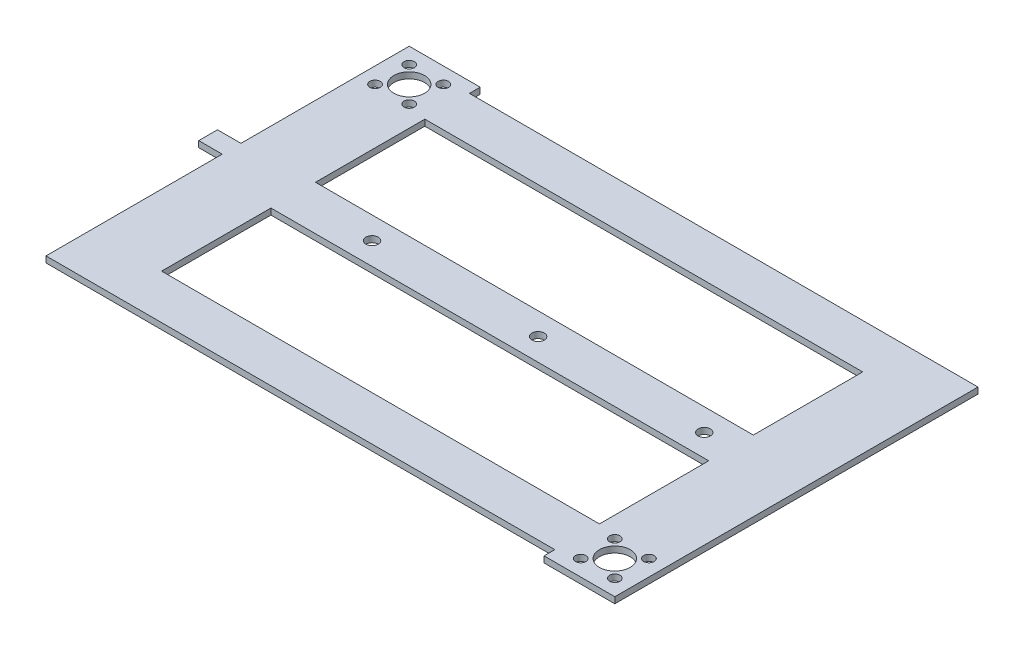
from build123d import *

# Parameters (mm, degrees)
SKETCH1_R           = 5
SKETCH1_R_2         = 1.7
SKETCH1_R_3         = 2
SKETCH1_W           = 142.3736446
SKETCH1_H           = 35.551129401
SKETCH1_H_2         = 35.551129402
BOSS_EXTRUDE1_DEPTH = 2


with BuildPart() as part:
    # Sketch1 → Boss-Extrude1 (new body)
    with BuildSketch(Plane(origin=(0, 0, 0), x_dir=(1, 0, 0), z_dir=(0, 1, 0))):
        Polygon((67.730491212, 150.133829438), (82.230491212, 150.133829438), (85.730491212, 150.133829438), (85.730491212, 100.082700036), (85.730491212, 85.582700036), (85.730491212, 50.031570635), (85.730491212, 32.031570635), (67.730491212, 32.031570635), (62.730491212, 32.031570635), (62.730491212, 35.531570635), (-84.727026002, 35.531570635), (-99.227026002, 35.531570635), (-102.727026002, 35.531570635), (-102.727026002, 85.582700036), (-102.727026002, 92.832700036), (-110.358379208, 92.832700036), (-110.358379208, 98.923608877), (-102.727026002, 98.923608877), (-102.727026002, 100.082700036), (-102.727026002, 153.633829438), (-84.643153388, 153.633829438), (-79.643153388, 153.633829438), (-79.643153388, 153.432122466), (-79.643153388, 150.133829438), align=None)
        with Locations((-91.977026002, 142.883829438)):
            Circle(SKETCH1_R, mode=Mode.SUBTRACT)
        with Locations((74.980491212, 42.781570635)):
            Circle(SKETCH1_R, mode=Mode.SUBTRACT)
        with Locations((-86.427026002, 148.433829438)):
            Circle(SKETCH1_R_2, mode=Mode.SUBTRACT)
        with Locations((-97.527026002, 148.433829438)):
            Circle(SKETCH1_R_2, mode=Mode.SUBTRACT)
        with Locations((-86.427026002, 137.333829438)):
            Circle(SKETCH1_R_2, mode=Mode.SUBTRACT)
        with Locations((-97.527026002, 137.333829438)):
            Circle(SKETCH1_R_2, mode=Mode.SUBTRACT)
        with Locations((69.430491212, 48.331570635)):
            Circle(SKETCH1_R_2, mode=Mode.SUBTRACT)
        with Locations((80.530491212, 48.331570635)):
            Circle(SKETCH1_R_2, mode=Mode.SUBTRACT)
        with Locations((80.530491212, 37.231570635)):
            Circle(SKETCH1_R_2, mode=Mode.SUBTRACT)
        with Locations((69.430491212, 37.231570635)):
            Circle(SKETCH1_R_2, mode=Mode.SUBTRACT)
        with Locations((-54, 92.833829438)):
            Circle(SKETCH1_R_3, mode=Mode.SUBTRACT)
        with Locations((0, 92.833829438)):
            Circle(SKETCH1_R_3, mode=Mode.SUBTRACT)
        with Locations((54, 92.833829438)):
            Circle(SKETCH1_R_3, mode=Mode.SUBTRACT)
        with Locations((-8.456331088, 67.807135336)):
            Rectangle(SKETCH1_W, SKETCH1_H, mode=Mode.SUBTRACT)
        with Locations((-8.456331088, 117.858264737)):
            Rectangle(SKETCH1_W, SKETCH1_H_2, mode=Mode.SUBTRACT)
    extrude(amount=BOSS_EXTRUDE1_DEPTH)


solid = part.part
